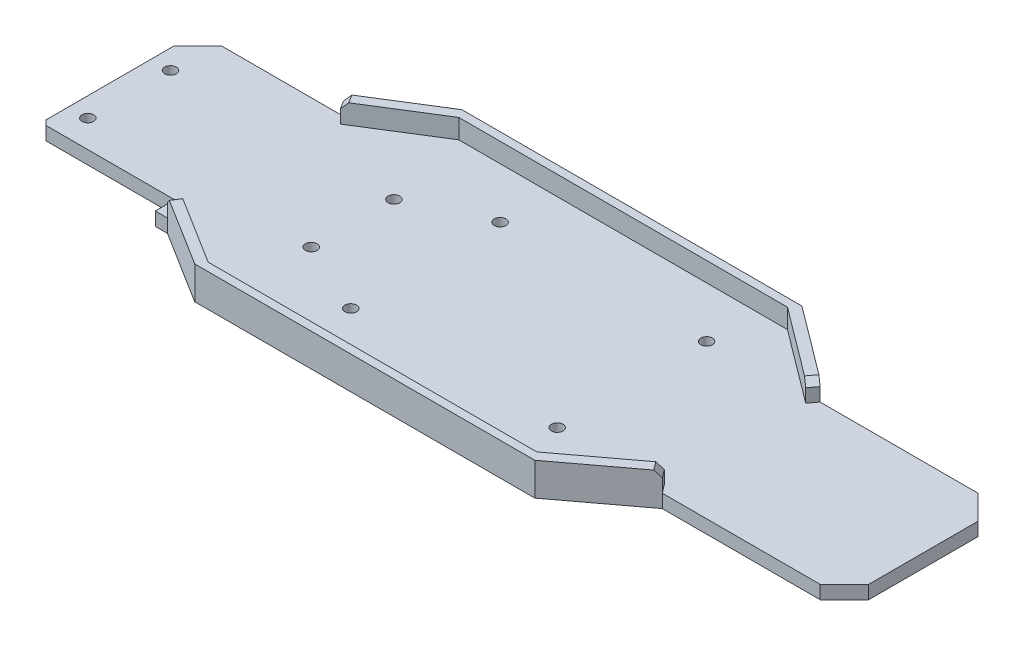
from build123d import *

# Parameters (mm, degrees)
BOSS_EXTRUDE1_DEPTH  = 5.5
CHASSIS_WALLS1_DEPTH = 8
CHAMFER1_SIZE        = 10
CHAMFER2_SIZE        = 10
CHAMFER3_SIZE        = 2.5
SKETCH4_R            = 2.4
CUT_EXTRUDE1_DEPTH   = 10
SKETCH5_W            = 55
SKETCH5_H            = 8
CUT_EXTRUDE2_DEPTH   = 10


with BuildPart() as part:
    # Sketch1 → Boss-Extrude1 (new body)
    with BuildSketch(Plane(origin=(0, 0, 0), x_dir=(1, 0, 0), z_dir=(0, 1, 0))):
        Polygon((-100, 36.25), (-70, 55), (70, 55), (100, 32.5), (175, 32.5), (175, -32.5), (100, -32.5), (70, -55), (-70, -55), (-100, -36.25), (-160, -36.25), (-160, 36.25), align=None)
    extrude(amount=BOSS_EXTRUDE1_DEPTH)

    # Sketch3 → Chassis-Walls1 (add)
    with BuildSketch(Plane(origin=(0, 5.5, 0), x_dir=(1, 0, 0), z_dir=(0, 1, 0))):
        Polygon((0, 55), (-70, 55), (-100, 36.25), (-97.88000424, 32.858006784), (-67.88000424, 51.608006784), (0, 51.608006784), (67.456005088, 51.608006784), (97.456005088, 29.108006784), (100, 32.5), (70, 55), align=None)
        Polygon((67.456005088, -51.608006784), (0, -51.608006784), (-67.88000424, -51.608006784), (-97.88000424, -32.858006784), (-100, -36.25), (-70, -55), (0, -55), (70, -55), (100, -32.5), (97.456005088, -29.108006784), align=None)
    extrude(amount=CHASSIS_WALLS1_DEPTH)

    # Chamfer1
    chamfer1_edges = [part.edges().sort_by_distance(p)[0] for p in [
        (-160, 2.75, -36.25),
        (-160, 2.75, 36.25),
    ]]
    chamfer(chamfer1_edges, length=CHAMFER1_SIZE)

    # Chamfer2
    chamfer2_edges = [part.edges().sort_by_distance(p)[0] for p in [
        (175, 2.75, -32.5),
        (175, 2.75, 32.5),
    ]]
    chamfer(chamfer2_edges, length=CHAMFER2_SIZE)

    # Chamfer3
    chamfer3_edges = [part.edges().sort_by_distance(p)[0] for p in [
        (-98.94000212, 13.5, -34.554003392),
        (-98.94000212, 13.5, 34.554003392),
        (98.728002544, 13.5, 30.804003392),
        (98.728002544, 13.5, -30.804003392),
    ]]
    chamfer(chamfer3_edges, length=CHAMFER3_SIZE)

    # Sketch4 → Cut-Extrude1 (cut)
    with BuildSketch(Plane.XZ):
        with Locations((-152, 17)):
            Circle(SKETCH4_R)
        with Locations((-60, 17)):
            Circle(SKETCH4_R)
        with Locations((-60, -17)):
            Circle(SKETCH4_R)
        with Locations((-152, -17)):
            Circle(SKETCH4_R)
        with Locations((-30, 30.75)):
            Circle(SKETCH4_R)
        with Locations((55, 30.75)):
            Circle(SKETCH4_R)
        with Locations((55, -30.75)):
            Circle(SKETCH4_R)
        with Locations((-30, -30.75)):
            Circle(SKETCH4_R)
    extrude(amount=-CUT_EXTRUDE1_DEPTH, mode=Mode.SUBTRACT)

    # Sketch5 → Cut-Extrude2 (cut)
    with BuildSketch(Plane(origin=(0, 5.5, 0), x_dir=(1, 0, 0), z_dir=(0, 1, 0))):
        with Locations((-132.5, -32.25)):
            Rectangle(SKETCH5_W, SKETCH5_H)
    extrude(amount=-CUT_EXTRUDE2_DEPTH, mode=Mode.SUBTRACT)


solid = part.part
